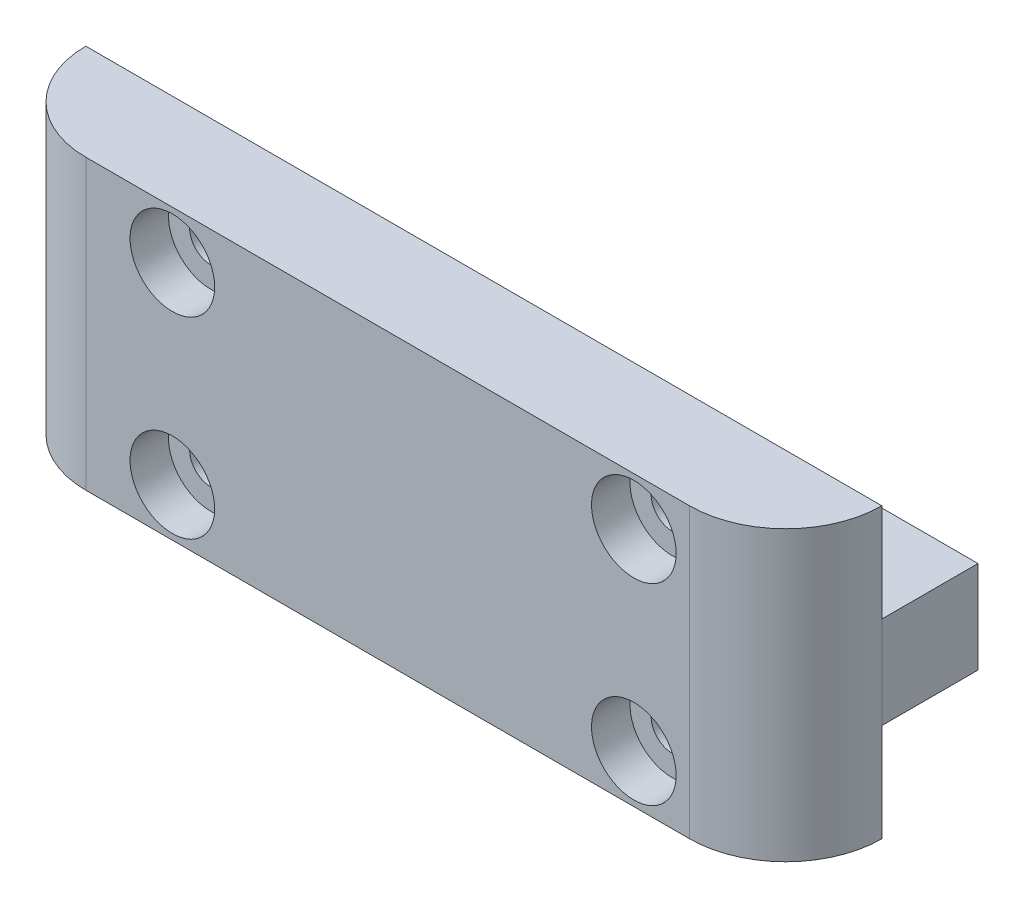
from build123d import *

# Parameters (mm, degrees)
SKETCH1_W                      = 41.4
SKETCH1_H                      = 15
SKETCH1_R                      = 1.1
BOSS_EXTRUDE1_DEPTH            = 5
SKETCH2_W                      = 41.4
SKETCH2_H                      = 4.8
BOSS_EXTRUDE2_DEPTH            = 5
CBORE_FOR_M2_SHCS1_D           = 2.2
CBORE_FOR_M2_SHCS1_CBORE_D     = 4.4
CBORE_FOR_M2_SHCS1_CBORE_DEPTH = 2
FILLET1_R                      = 5


with BuildPart() as part:
    # Sketch1 → Boss-Extrude1 (new body)
    with BuildSketch(Plane.XY):
        Rectangle(SKETCH1_W, SKETCH1_H)
        with Locations((-11.2, 5)):
            Circle(SKETCH1_R, mode=Mode.SUBTRACT)
        with Locations((12.8, 5)):
            Circle(SKETCH1_R, mode=Mode.SUBTRACT)
        with Locations(Location((12.8, -5, 0), (0, 0, 180))):
            Circle(SKETCH1_R, mode=Mode.SUBTRACT)
        with Locations(Location((-11.2, -5, 0), (0, 0, 180))):
            Circle(SKETCH1_R, mode=Mode.SUBTRACT)
    extrude(amount=BOSS_EXTRUDE1_DEPTH)

    # Sketch2 → Boss-Extrude2 (add)
    with BuildSketch(Plane.XY):
        Rectangle(SKETCH2_W, SKETCH2_H)
    extrude(amount=-BOSS_EXTRUDE2_DEPTH)

    # CBORE for M2 SHCS1 (through all)
    with Locations(Plane.XY.offset(5)):
        with Locations((-11.2, 5), (12.8, 5), (12.8, -5), (-11.2, -5)):
            CounterBoreHole(CBORE_FOR_M2_SHCS1_D / 2, CBORE_FOR_M2_SHCS1_CBORE_D / 2, CBORE_FOR_M2_SHCS1_CBORE_DEPTH)

    # Fillet1
    fillet1_edges = [part.edges().sort_by_distance(p)[0] for p in [
        (-20.7, 0, 5),
        (20.7, 0, 5),
    ]]
    fillet(fillet1_edges, radius=FILLET1_R - 0.0001)  # a hair under: the kernel refuses the full size


solid = part.part
